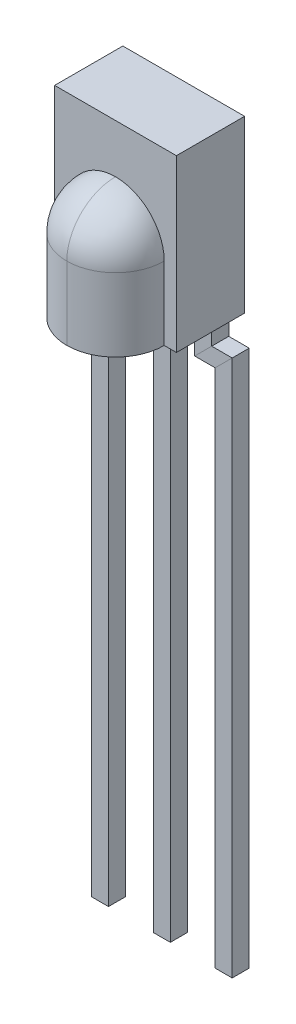
from build123d import *

# Parameters (mm, degrees)
IZIM1_W                     = 5
IZIM1_H                     = 7
Y_KSEKLIK_EKSTR_ZYON1_DEPTH = 2.8
IZIM2_W                     = 4
IZIM2_H                     = 5
Y_KSEKLIK_EKSTR_ZYON2_DEPTH = 2
RADYUS2_R                   = 2
IZIM3_W                     = 0.7
IZIM3_H                     = 0.7
IZIM5_W                     = 0.7
IZIM5_H                     = 0.7


with BuildPart() as part:
    # Çizim1 → Yükseklik-Ekstrüzyon1 (new body)
    with BuildSketch(Plane.XY):
        with Locations((2.5, 3.5)):
            Rectangle(IZIM1_W, IZIM1_H)
    extrude(amount=Y_KSEKLIK_EKSTR_ZYON1_DEPTH)

    # Çizim2 → Yükseklik-Ekstrüzyon2 (add)
    with BuildSketch(Plane.XY.offset(2.8)):
        with Locations((2.5, 2.5)):
            Rectangle(IZIM2_W, IZIM2_H)
    extrude(amount=Y_KSEKLIK_EKSTR_ZYON2_DEPTH)

    # Radyus2
    radyus2_edges = [part.edges().sort_by_distance(p)[0] for p in [
        (4.5, 2.5, 4.8),
    ]]
    fillet(radyus2_edges, radius=RADYUS2_R - 0.0001)  # a hair under: the kernel refuses the full size
    radyus2_2_edges = [part.edges().sort_by_distance(p)[0] for p in [
        (1.50005, 5, 4.8),
    ]]
    fillet(radyus2_2_edges, radius=RADYUS2_R - 0.0001)  # a hair under: the kernel refuses the full size
    radyus2_3_edges = [part.edges().sort_by_distance(p)[0] for p in [
        (0.5, 1.50005, 4.8),
    ]]
    fillet(radyus2_3_edges, radius=RADYUS2_R - 0.0001)  # a hair under: the kernel refuses the full size

    # Süpür1: sweep along a path in Çizim4
    with BuildLine(Plane(origin=(0, 0, 0.55), x_dir=(-1, 0, 0), z_dir=(0, 0, -1))) as s_p_r1_path:
        Line((-4.2, 0), (-4.2, -1.3))
        Line((-4.2, -1.3), (-5.04, -1.3))
        Line((-5.04, -1.3), (-5.04, -23))
    # Çizim3 → Süpür1 (sweep)
    with BuildSketch(Plane.XZ):
        with Locations((4.2, 0.55)):
            Rectangle(IZIM3_W, IZIM3_H)
    s_p_r1 = sweep(path=s_p_r1_path.line, transition=Transition.RIGHT)

    # Aynalama1: Süpür1 across plane
    add(s_p_r1.mirror(Plane(origin=(2.5, 0, 0), x_dir=(0, 0, 1), z_dir=(1, 0, 0))))

    # Süpür2: sweep along a path in Çizim6
    with BuildLine(Plane(origin=(0, 0, 0.55), x_dir=(-1, 0, 0), z_dir=(0, 0, -1))) as s_p_r2_path:
        Line((-2.5, 0), (-2.5, -23.002662889))
    # Çizim5 → Süpür2 (sweep)
    with BuildSketch(Plane.XZ):
        with Locations((2.5, 0.55)):
            Rectangle(IZIM5_W, IZIM5_H)
    sweep(path=s_p_r2_path.line)


solid = part.part
